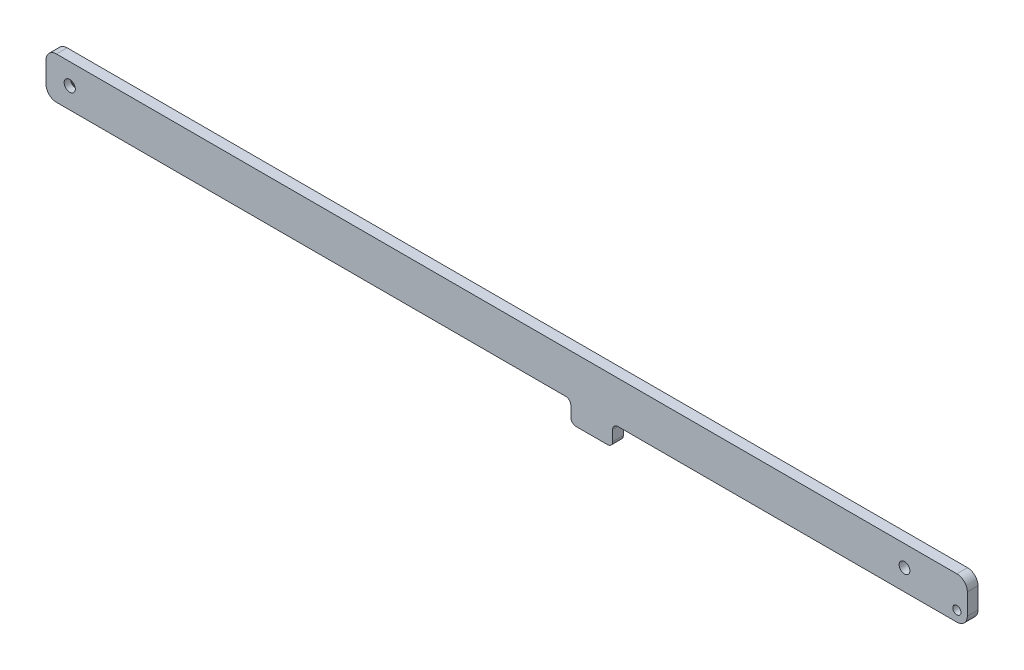
from build123d import *

# Parameters (mm, degrees)
SKETCH1_R                                           = 2.4892
BOSS_EXTRUDE1_DEPTH                                 = 6.477
FILLET2_R                                           = 6.35
FILLET3_R                                           = 3.175
SKETCH2_R                                           = 3.2639
CUT_EXTRUDE1_DEPTH                                  = 560.526948516
CSK_FOR_1_4_FLAT_HEAD_MACHINE_SCREW_100_D           = 6.7564
CSK_FOR_1_4_FLAT_HEAD_MACHINE_SCREW_100_DEPTH       = 19.05
CSK_FOR_1_4_FLAT_HEAD_MACHINE_SCREW_100_CSINK_D     = 12.8778
CSK_FOR_1_4_FLAT_HEAD_MACHINE_SCREW_100_CSINK_ANGLE = 100
CSK_FOR_1_4_FLAT_HEAD_MACHINE_SCREW_100_TIP         = 2.029827343


with BuildPart() as part:
    # Sketch1 → Boss-Extrude1 (new body)
    with BuildSketch(Plane.XY):
        Polygon((0, 25.4), (0, 0), (40.53078, 0), (318.31026, 0), (318.31026, -12.7), (343.71026, -12.7), (343.71026, 0), (558.8, 0), (558.8, 25.4), (40.530665192, 25.4), align=None)
        with Locations((552.45, 6.35)):
            Circle(SKETCH1_R, mode=Mode.SUBTRACT)
    extrude(amount=BOSS_EXTRUDE1_DEPTH)

    # Fillet2
    fillet2_edges = [part.edges().sort_by_distance(p)[0] for p in [
        (558.8, 25.4, 3.2385),
        (0, 0, 3.2385),
        (0, 25.4, 3.2385),
        (558.8, 0, 3.2385),
    ]]
    fillet(fillet2_edges, radius=FILLET2_R)


with BuildPart() as body_2:
    # Mirror2: mirrored copy
    add(part.part.mirror(Plane.XY))

    # Fillet3
    fillet3_edges = [body_2.edges().sort_by_distance(p)[0] for p in [
        (343.71026, 0, -3.2385),
        (343.71026, -12.7, -3.2385),
        (318.31026, -12.7, -3.2385),
        (318.31026, 0, -3.2385),
    ]]
    fillet(fillet3_edges, radius=FILLET3_R)

    # Sketch2 → Cut-Extrude1 (cut, through all)
    with BuildSketch(Plane.XY.offset(6.477)):
        with Locations((520.7, 12.7)):
            Circle(SKETCH2_R)
    extrude(amount=-CUT_EXTRUDE1_DEPTH, mode=Mode.SUBTRACT)

    # CSK for 1/4 Flat Head Machine Screw (100)1
    with Locations(Plane(origin=(0, 0, -6.477), x_dir=(1, 0, 0), z_dir=(0, 0, -1))):
        with Locations((14.393926, -12.7)):
            CounterSinkHole(CSK_FOR_1_4_FLAT_HEAD_MACHINE_SCREW_100_D / 2, CSK_FOR_1_4_FLAT_HEAD_MACHINE_SCREW_100_CSINK_D / 2, depth=CSK_FOR_1_4_FLAT_HEAD_MACHINE_SCREW_100_DEPTH, counter_sink_angle=CSK_FOR_1_4_FLAT_HEAD_MACHINE_SCREW_100_CSINK_ANGLE)
            with Locations((0, 0, -(CSK_FOR_1_4_FLAT_HEAD_MACHINE_SCREW_100_DEPTH + CSK_FOR_1_4_FLAT_HEAD_MACHINE_SCREW_100_TIP / 2))):  # 118° drill point
                Cone(0, CSK_FOR_1_4_FLAT_HEAD_MACHINE_SCREW_100_D / 2, CSK_FOR_1_4_FLAT_HEAD_MACHINE_SCREW_100_TIP, mode=Mode.SUBTRACT)


solid = body_2.part
